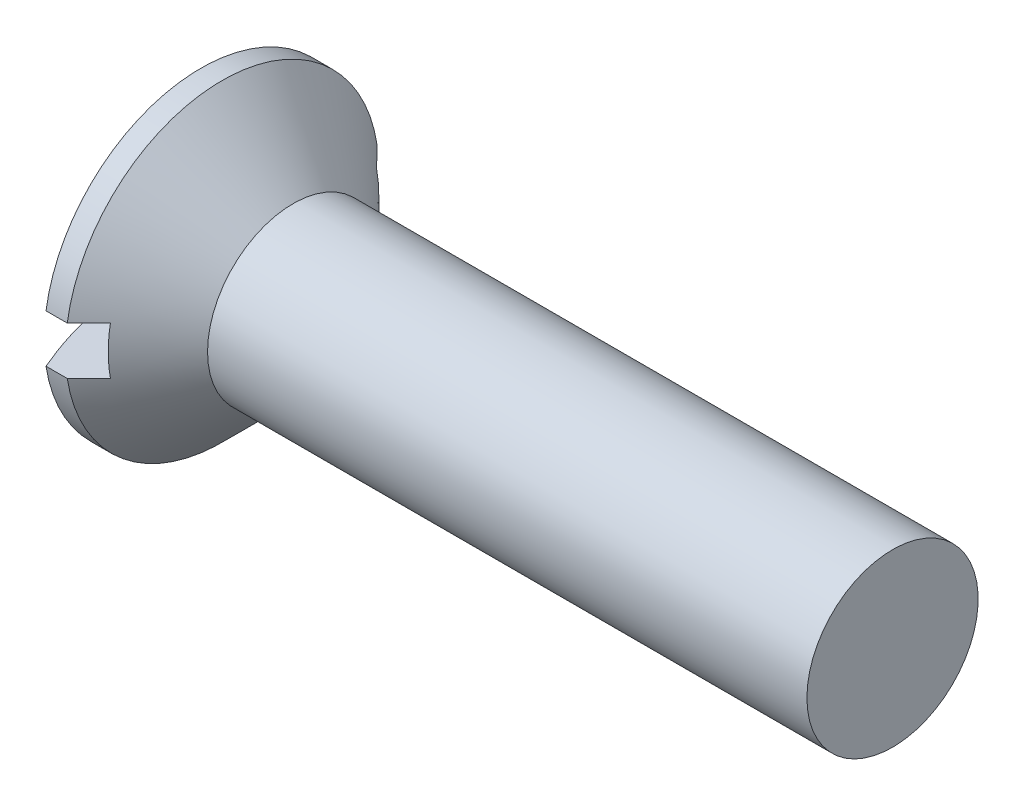
from build123d import *

# Parameters (mm, degrees)
SKETCH2_W         = 18.3
SKETCH2_H         = 2.8
SLOT_DEPTH        = 4.4
CIRPATTERN1_COUNT = 2
CIRPATTERN1_ANGLE = 90


with BuildPart() as part:
    # BodySke → Base-Revolve (revolve)
    with BuildSketch(Plane.XY):
        with BuildLine():
            Line((0, 0), (42.298786444, 0))
            Line((42.298786444, 0), (42.298786444, 5))
            Line((42.298786444, 5), (7.298786444, 5))
            Line((7.298786444, 5), (3.148786444, 9.15))
            Line((3.148786444, 9.15), (1.907441795, 9.15))
            ThreePointArc((1.907441795, 9.15), (0.481931585, 4.673350891), (0, 0))
        make_face()
    revolve(axis=Axis((-15.875, 0, 0), (1, 0, 0)))

    # Sketch2 → Slot (cut)
    with BuildSketch(Plane(origin=(0, 0, 0), x_dir=(0, 0, -1), z_dir=(1, 0, 0))):
        Rectangle(SKETCH2_W, SKETCH2_H)
    extrude(amount=SLOT_DEPTH, mode=Mode.SUBTRACT)

    # Sketch3 → Cross section 0
    with BuildSketch(Plane(origin=(0, 0, 0), x_dir=(0, 0, -1), z_dir=(1, 0, 0))):
        with BuildLine():
            Line((1.085, -5.62), (-1.085, -5.62))
            Line((-1.085, -5.62), (-1.085, 5.62))
            Line((-1.085, 5.62), (1.085, 5.62))
            Line((1.085, 5.62), (1.085, -5.62))
        make_face()
    # Sketch4 → Cross section 1
    with BuildSketch(Plane(origin=(7.15, 0, 0), x_dir=(0, 0, -1), z_dir=(1, 0, 0))):
        with BuildLine():
            Line((0.5425, -0.5425), (-0.5425, -0.5425))
            Line((-0.5425, -0.5425), (-0.5425, 0.5425))
            Line((-0.5425, 0.5425), (0.5425, 0.5425))
            Line((0.5425, 0.5425), (0.5425, -0.5425))
        make_face()
    cross = loft(mode=Mode.SUBTRACT)

    # CirPattern1: Cross ×2 about axis
    cirpattern1_axis = Axis((-15.875, 0, 0), (1, 0, 0))
    for i in range(1, CIRPATTERN1_COUNT):
        add(cross.rotate(cirpattern1_axis, i * CIRPATTERN1_ANGLE / (CIRPATTERN1_COUNT - 1)), mode=Mode.SUBTRACT)


solid = part.part
